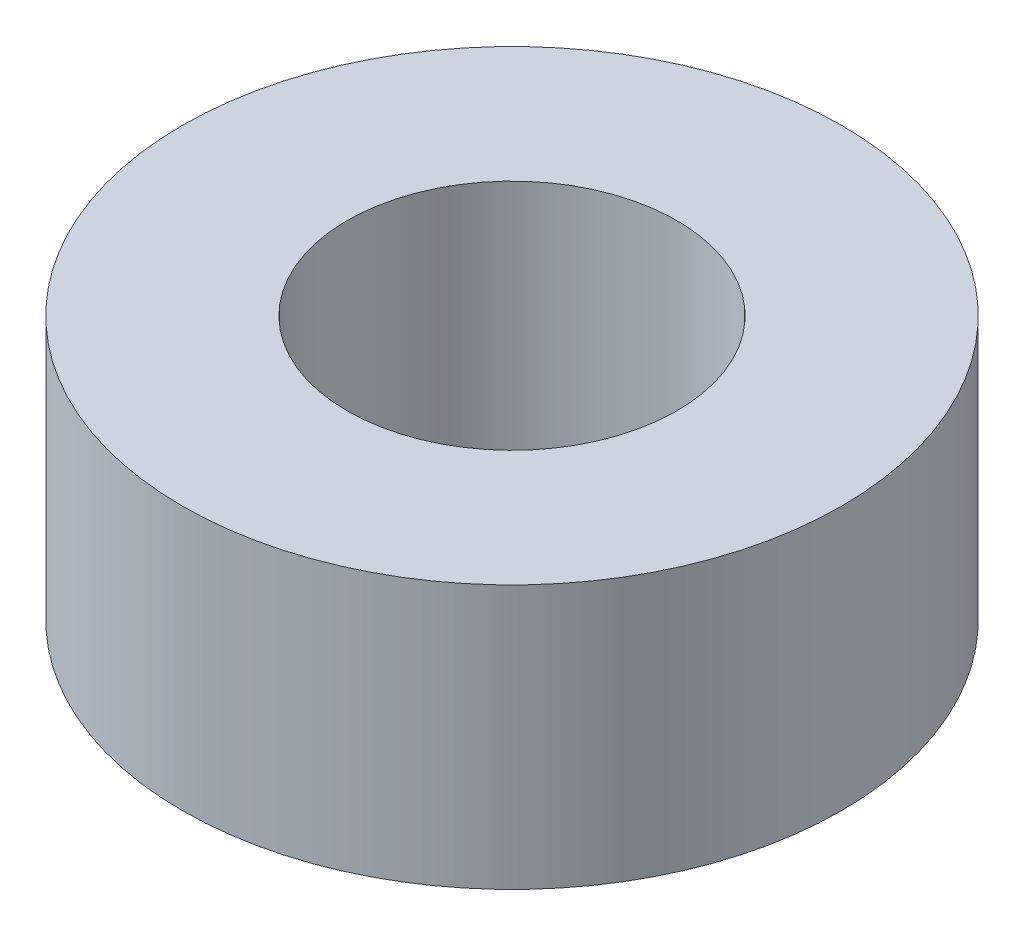
from build123d import *

# Parameters (mm, degrees)
SZKIC1_R                    = 5
SZKIC1_R_2                  = 2.5
DODANIE_WYCI_GNI_CIE1_DEPTH = 4


with BuildPart() as part:
    # Szkic1 → Dodanie-wyciągnięcie1 (new body)
    with BuildSketch(Plane(origin=(0, 0, 0), x_dir=(1, 0, 0), z_dir=(0, 1, 0))):
        Circle(SZKIC1_R)
        Circle(SZKIC1_R_2, mode=Mode.SUBTRACT)
    extrude(amount=DODANIE_WYCI_GNI_CIE1_DEPTH)


solid = part.part
